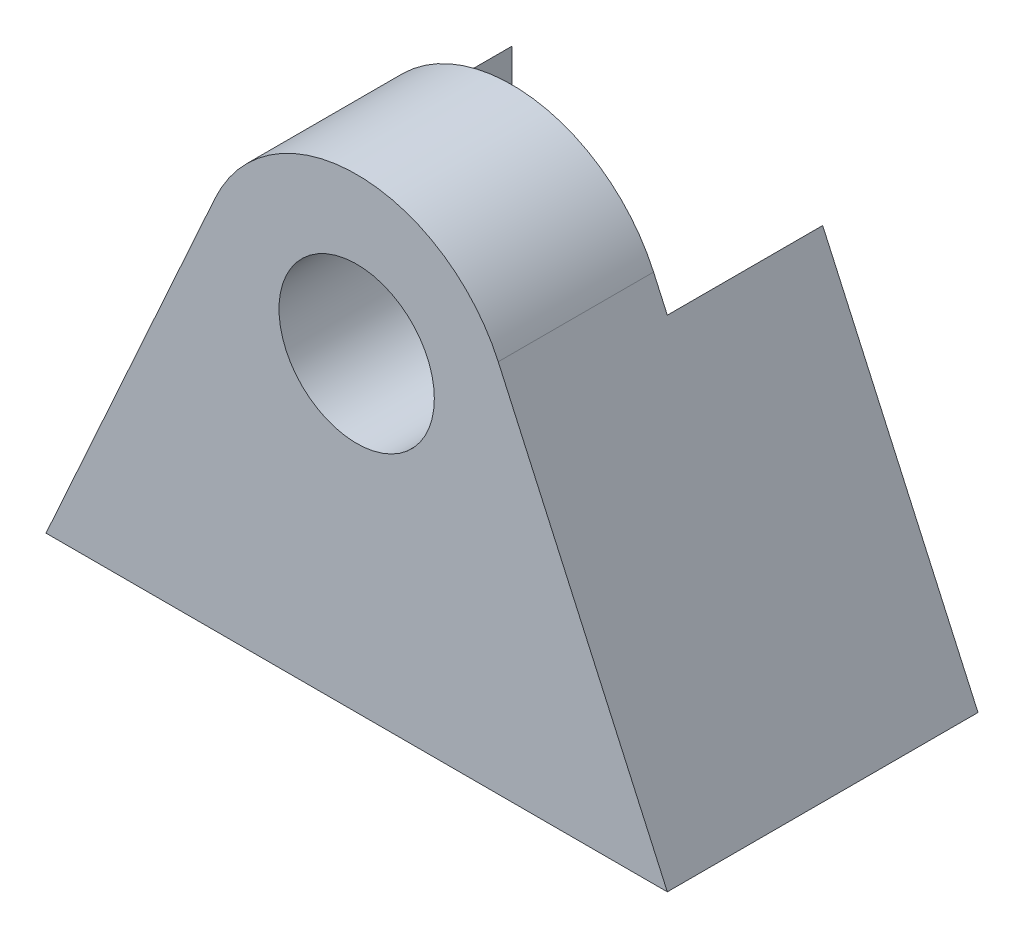
from build123d import *

# Parameters (mm, degrees)
SKETCH2_R           = 3.175
BOSS_EXTRUDE2_DEPTH = 6.35
SKETCH6_W           = 12.7
SKETCH6_H           = 12.7
CUT_EXTRUDE3_DEPTH  = 6.35
SKETCH7_R           = 1.905
CUT_EXTRUDE4_DEPTH  = 6.35


with BuildPart() as part:
    # Sketch2 → Boss-Extrude2 (new, symmetric)
    with BuildSketch(Plane.XY):
        with BuildLine():
            Line((0, 0), (25.4, 0))
            Line((25.4, 0), (18.487630206, 15.312630206))
            ThreePointArc((18.487630206, 15.312630206), (12.7, 19.05), (6.912369794, 15.312630206))
            Line((6.912369794, 15.312630206), (0, 0))
        make_face()
        with Locations((12.7, 12.7)):
            Circle(SKETCH2_R, mode=Mode.SUBTRACT)
    extrude(amount=BOSS_EXTRUDE2_DEPTH, both=True)

    # Sketch6 → Cut-Extrude3 (cut)
    with BuildSketch(Plane.XY):
        with Locations((12.7, 12.7)):
            Rectangle(SKETCH6_W, SKETCH6_H)
    extrude(amount=-CUT_EXTRUDE3_DEPTH, mode=Mode.SUBTRACT)

    # Sketch7 → Cut-Extrude4 (cut)
    with BuildSketch(Plane(origin=(0, 6.35, 0), x_dir=(1, 0, 0), z_dir=(0, 1, 0))):
        with Locations((6.35, 3.175)):
            Circle(SKETCH7_R)
        with Locations((19.05, 3.175)):
            Circle(SKETCH7_R)
    extrude(amount=-CUT_EXTRUDE4_DEPTH, mode=Mode.SUBTRACT)


solid = part.part
